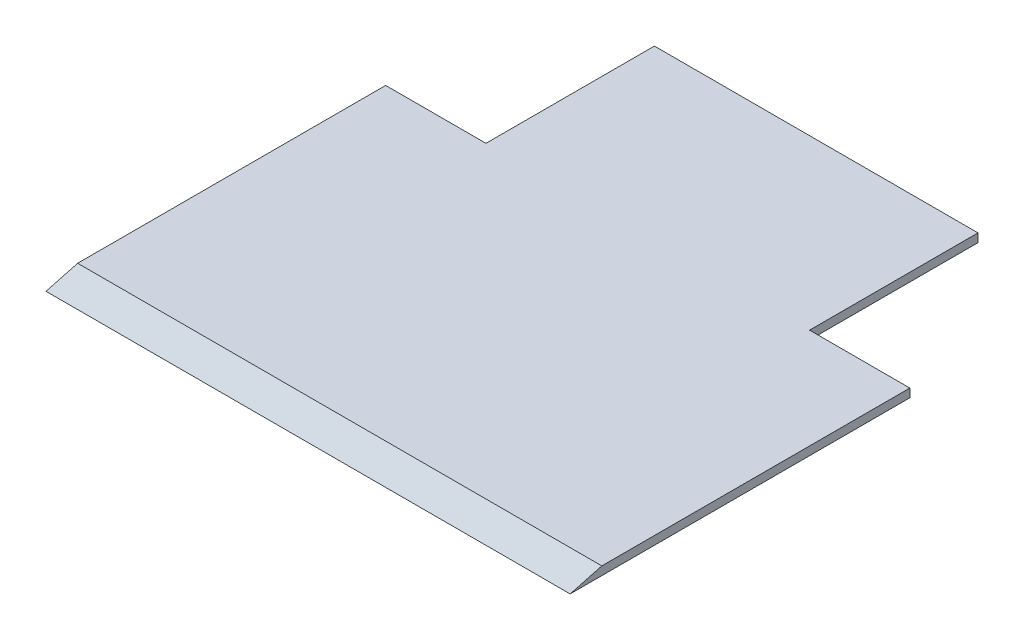
from build123d import *

# Parameters (mm, degrees)
SALIENTE_EXTRUIR1_DEPTH = 196
CORTAR_EXTRUIR1_REACH   = 274.995
CROQUIS2_W              = 37.5
CROQUIS2_H              = 62.989872981


with BuildPart() as part:
    # Croquis1 → Saliente-Extruir1 (new body)
    with BuildSketch(Plane(origin=(0, 0, 0), x_dir=(0, 0, -1), z_dir=(1, 0, 0))):
        Polygon((0, 0), (190, 0), (190, 3.17), (11.83060106, 3.17), align=None)
    extrude(amount=SALIENTE_EXTRUIR1_DEPTH)

    # Croquis2 → Cortar-Extruir1 (cut, up to next)
    with BuildSketch(Plane(origin=(0, 0, 0), x_dir=(-1, 0, 0), z_dir=(0, -1, 0)), mode=Mode.PRIVATE) as cortar_extruir1_sk1:
        with Locations((-18.75, 158.50506351)):
            Rectangle(CROQUIS2_W, CROQUIS2_H)
    cortar_extruir1_tool1 = extrude(cortar_extruir1_sk1.sketch, amount=-CORTAR_EXTRUIR1_REACH, mode=Mode.PRIVATE) & part.part
    cortar_extruir1 = cortar_extruir1_tool1.solids().sort_by_distance((18.75, 0, -158.505064))[0]
    add(cortar_extruir1, mode=Mode.SUBTRACT)

    # Simetría1: Cortar-Extruir1 across plane
    add(cortar_extruir1.mirror(Plane.ZY.offset(-98)), mode=Mode.SUBTRACT)


solid = part.part
